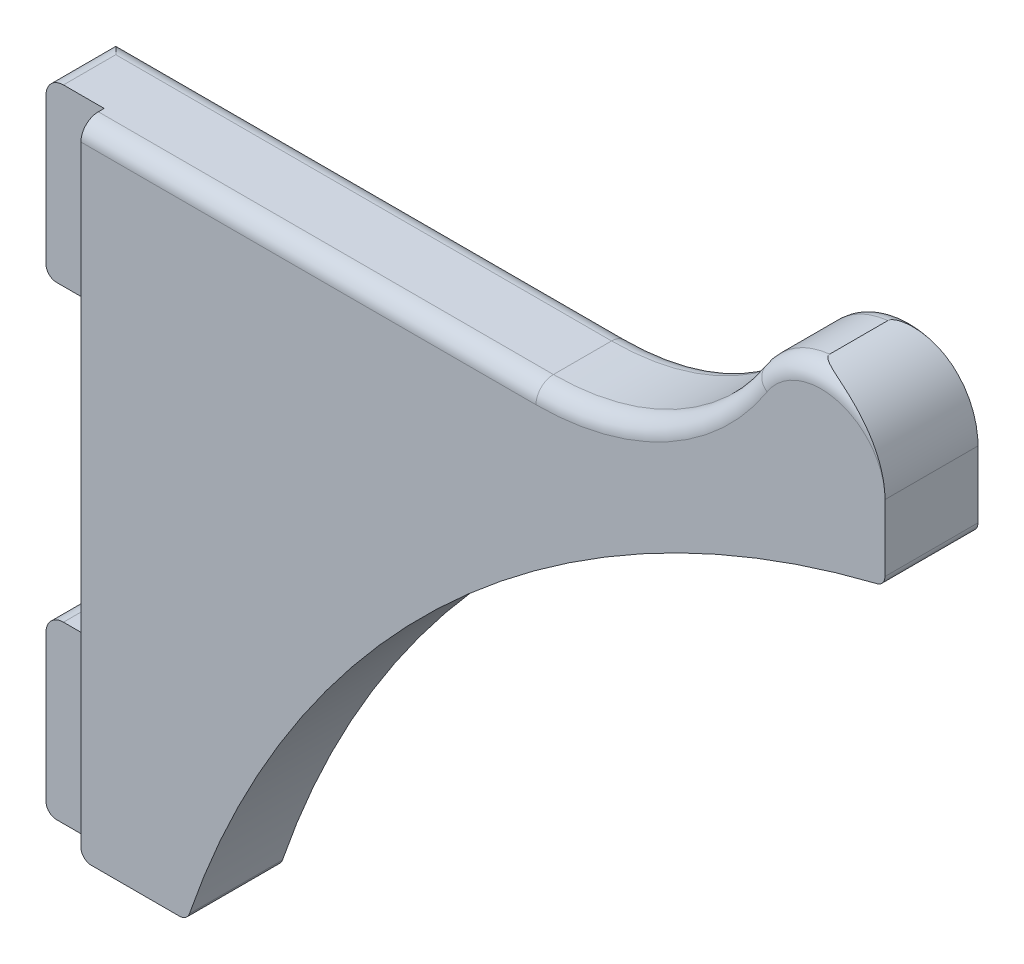
from build123d import *

# Parameters (mm, degrees)
BOSS_EXTRU_1_DEPTH      = 4
ENL_V_MAT_EXTRU_1_DEPTH = 2
CONG_4_R                = 7
CONG_3_R                = 0.9
CONG_5_R                = 1.5


with BuildPart() as part:
    # Esquisse1 → Boss.-Extru.1 (new, symmetric)
    with BuildSketch(Plane.XY):
        with BuildLine():
            Line((0, 0), (0, 9))
            Line((0, 9), (1, 9))
            Line((1, 9), (1, 0.09638948))
            Line((1, 0.09638948), (10.121873618, 0.09638948))
            ThreePointArc((10.121873618, 0.09638948), (32.996323667, 35.335168912), (70.121873618, 55))
            Line((70.121873618, 55), (70.121873618, 68.436194763))
            Line((70.121873618, 68.436194763), (60.432430442, 68.436194763))
            ThreePointArc((60.432430442, 68.436194763), (52.298183077, 58.663045958), (40.121873618, 55))
            Line((40.121873618, 55), (19.293191489, 55))
            Line((19.293191489, 55), (10.121873618, 55))
            Line((10.121873618, 55), (-4, 55))
            Line((-4, 55), (-4, 40))
            Line((-4, 40), (0, 40))
            Line((0, 40), (0, 49))
            Line((0, 49), (1, 49))
            Line((1, 49), (1, 15))
            Line((1, 15), (-4, 15))
            Line((-4, 15), (-4, 0))
            Line((-4, 0), (0, 0))
        make_face()
    extrude(amount=BOSS_EXTRU_1_DEPTH, both=True)

    # Esquisse4 → Enlèv. mat.-Extru.1 (cut)
    with BuildSketch(Plane.XY.offset(4)):
        Polygon((0, 40), (-4, 40), (-4, 55), (1, 55), (1, 40), align=None)
        Polygon((0, 0), (-4, 0), (-4, 15), (1, 15), (1, 0), align=None)
    extrude(amount=-ENL_V_MAT_EXTRU_1_DEPTH, mode=Mode.SUBTRACT)

    # Congé4
    # the kernel refuses this fillet: 7 mm, written as the material it takes off along each edge
    with BuildSketch(Plane(origin=(70.121873618, 68.436194763, -21.5), x_dir=(-1, 0, 0), z_dir=(0, 0, 1))) as cong_4_piece_1:
        with BuildLine():
            CenterArc((CONG_4_R, CONG_4_R), CONG_4_R, 180, 90)
            Line((0, CONG_4_R), (0, 0))
            Line((0, 0), (CONG_4_R, 0))
        make_face()
    extrude(amount=43, mode=Mode.SUBTRACT)
    with BuildSketch(Plane(origin=(60.432430442, 68.436194763, -14.492760312), x_dir=(-0.46608321311989886, -0.8847408877450115, 0), z_dir=(0, 0, 1))) as cong_4_piece_2:
        with BuildLine():
            CenterArc((4.236986438, 6.975932121), CONG_4_R, 207.780348291, 57.467043301)
            Line((-1.956199776, 3.713349629), (0, 0))
            ThreePointArc((0, 0), (1.828505702, 0.075879566), (3.657011403, 0))
        make_face()
    extrude(amount=28.985520624, mode=Mode.SUBTRACT)

    # Congé3
    # the kernel refuses this fillet: 0.9 mm, written as the material it adds along each edge
    with BuildSketch(Plane(origin=(1, 9, -4), x_dir=(-1, 0, 0), z_dir=(0, 0, 1)), Plane(origin=(0, 9, -4), x_dir=(0, -1, 0), z_dir=(0, 0, 1)), Plane(origin=(1, 15, -4), x_dir=(0, 1, 0), z_dir=(0, 0, 1))) as cong_3_piece_1:
        with BuildLine():
            CenterArc((CONG_3_R, CONG_3_R), CONG_3_R, 180, 90)
            Line((0, CONG_3_R), (0, 0))
            Line((0, 0), (CONG_3_R, 0))
        make_face()
    extrude(amount=6)
    with BuildSketch(Plane(origin=(1, 49, -4), x_dir=(0, -1, 0), z_dir=(0, 0, 1)), Plane(origin=(0, 49, -4), x_dir=(1, 0, 0), z_dir=(0, 0, 1))) as cong_3_piece_2:
        with BuildLine():
            CenterArc((CONG_3_R, -CONG_3_R), CONG_3_R, 90, 90)
            Line((0, -CONG_3_R), (0, 0))
            Line((0, 0), (CONG_3_R, 0))
        make_face()
    extrude(amount=6)
    # the kernel refuses this fillet: 0.9 mm, written as the material it takes off along each edge
    with BuildSketch(Plane(origin=(1, 0.09638948, -6.25), x_dir=(0, 1, 0), z_dir=(0, 0, 1))) as cong_3_2_piece_1:
        with BuildLine():
            CenterArc((CONG_3_R, -CONG_3_R), CONG_3_R, 90, 90)
            Line((0, -CONG_3_R), (0, 0))
            Line((0, 0), (CONG_3_R, 0))
        make_face()
    extrude(amount=12.5, mode=Mode.SUBTRACT)
    with BuildSketch(Plane(origin=(0, 0, 4.25), x_dir=(0, 1, 0), z_dir=(0, 0, -1)), Plane(origin=(-4, 0, 4.25), x_dir=(1, 0, 0), z_dir=(0, 0, -1))) as cong_3_2_piece_2:
        with BuildLine():
            CenterArc((CONG_3_R, -CONG_3_R), CONG_3_R, 90, 90)
            Line((0, -CONG_3_R), (0, 0))
            Line((0, 0), (CONG_3_R, 0))
        make_face()
    extrude(amount=10.5, mode=Mode.SUBTRACT)
    with BuildSketch(Plane(origin=(0, 40, -6.25), x_dir=(0, 1, 0), z_dir=(0, 0, 1)), Plane(origin=(-4, 40, -6.25), x_dir=(1, 0, 0), z_dir=(0, 0, 1))) as cong_3_2_piece_3:
        with BuildLine():
            CenterArc((CONG_3_R, CONG_3_R), CONG_3_R, 180, 90)
            Line((0, CONG_3_R), (0, 0))
            Line((0, 0), (CONG_3_R, 0))
        make_face()
    extrude(amount=10.5, mode=Mode.SUBTRACT)
    with BuildSketch(Plane(origin=(70.121873618, 55, -5.770556853), x_dir=(-0.9719612569458899, -0.2351410534044747, 0), z_dir=(0, 0, 1))) as cong_3_2_piece_4:
        with BuildLine():
            CenterArc((0.70823289, -0.899992014), CONG_3_R, 90.241370438, 76.15869203)
            Line((-0.166532241, -0.688365066), (0, 0))
            ThreePointArc((0, 0), (0.352220732, -0.000741903), (0.704441463, 0))
        make_face()
    extrude(amount=11.541113707, mode=Mode.SUBTRACT)
    with BuildSketch(Plane(origin=(10.121873618, 0.09638948, -5.615046517), x_dir=(-1, 0, 0), z_dir=(0, 0, 1))) as cong_3_2_piece_5:
        with BuildLine():
            CenterArc((0.646018607, -0.9), CONG_3_R, 90, 71.121872084)
            ThreePointArc((-0.205569441, -0.608799388), (-0.102199862, -0.304597179), (0, 0))
            Line((0, 0), (0.646018607, 0))
        make_face()
    extrude(amount=11.230093034, mode=Mode.SUBTRACT)

    # Congé5
    cong_5_edges = [part.edges().sort_by_distance(p)[0] for p in [
        (50.731308414, 57.717480203, -4),
        (60.938289065, 67.383858728, -4),
        (50.731308414, 57.717480203, 4),
        (60.938289065, 67.383858728, 4),
        (18.060936809, 55, -4),
        (20.560936809, 55, 4),
        (-4, 15, -1),
        (-4, 55, -1),
    ]]
    fillet(cong_5_edges, radius=CONG_5_R)


solid = part.part
